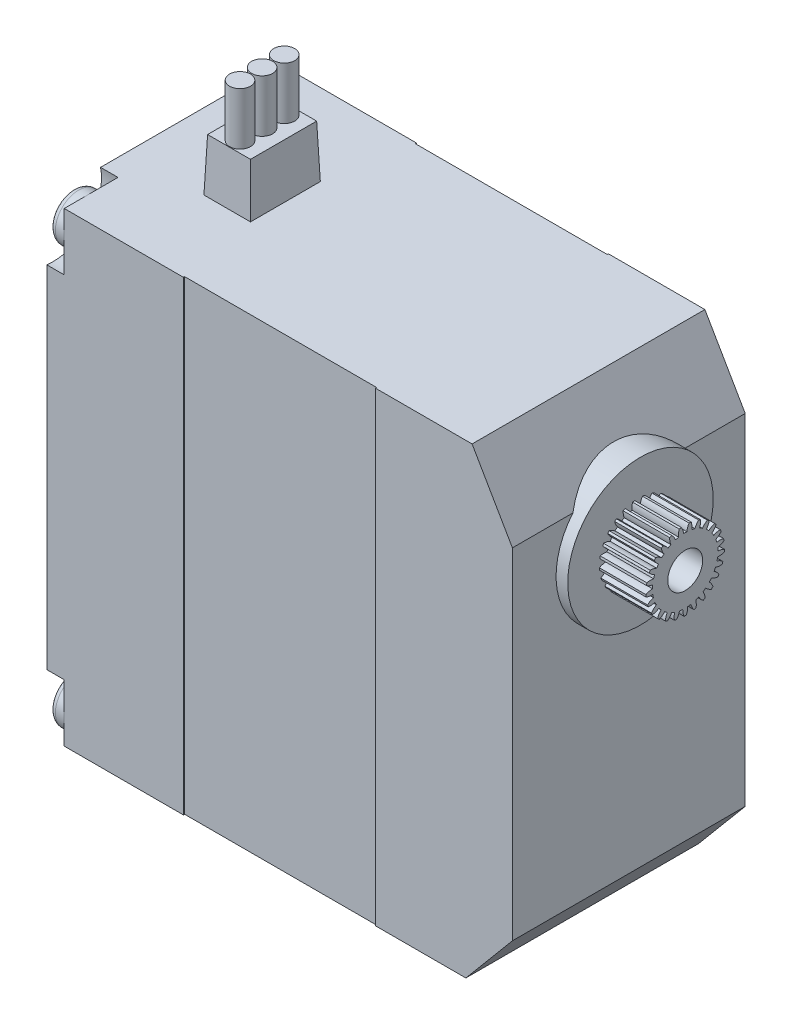
from build123d import *

# Parameters (mm, degrees)
SKETCH_1_W                     = 40
SKETCH_1_H                     = 40
EXTRUDE_1_DEPTH                = 20
SKETCH_2_R                     = 6.25
EXTRUDE_2_DEPTH                = 1
SKETCH_10_W                    = 16.5
SKETCH_10_H                    = 40
CUT_EXTRUDE_5_DEPTH            = 0.1
SKETCH_11_W                    = 16.5
SKETCH_11_H                    = 40
CUT_EXTRUDE_6_DEPTH            = 0.1
EXTRUDE_6_DEPTH                = 4
SKETCH_15_R                    = 1.5
CUT_EXTRUDE_9_DEPTH            = 4
CHAMFER_2_SIZE                 = 6
CHAMFER_2_SIZE_2               = 3.464101615
CHAMFER_3_SIZE                 = 4
CHAMFER_3_SIZE2                = 4.76701437
CUT_EXTRUDE_13_DEPTH           = 1.5
SKETCH_25_R                    = 2
EXTRUDE_10_DEPTH               = 1.3
FILLET_5_R                     = 0.5
CUT_EXTRUDE_14_DEPTH           = 0.8
CUT_EXTRUDE_14_DRAFT           = -16
CUT_EXTRUDE_14_PROFILE_2_DEPTH = 0.8
CUT_EXTRUDE_14_PROFILE_2_DRAFT = -16
CUT_EXTRUDE_14_PROFILE_3_DEPTH = 0.8
CUT_EXTRUDE_14_PROFILE_3_DRAFT = -16
CUT_EXTRUDE_14_PROFILE_4_DEPTH = 0.8
CUT_EXTRUDE_14_PROFILE_4_DRAFT = -16
EXTRUDE_11_DEPTH               = 4.5
EXTRUDE_11_TAPER               = 2
SKETCH_29_R                    = 0.9
EXTRUDE_12_DEPTH               = 4.5


with BuildPart() as part:
    # 草图1 → 凸台-拉伸1 (new body)
    with BuildSketch(Plane.XY):
        Rectangle(SKETCH_1_W, SKETCH_1_H)
    extrude(amount=EXTRUDE_1_DEPTH)

    # 草图2 → 凸台-拉伸2 (add)
    with BuildSketch(Plane(origin=(20, 0, 0), x_dir=(0, 0, -1), z_dir=(1, 0, 0))):
        with Locations(Location((-10, 10, 0), (0, 0, 180))):
            Circle(SKETCH_2_R)
    extrude(amount=EXTRUDE_2_DEPTH)

    # 草图10 → 切除-拉伸5 (cut)
    with BuildSketch(Plane(origin=(0, 0, 0), x_dir=(-1, 0, 0), z_dir=(0, 0, -1))):
        Rectangle(SKETCH_10_W, SKETCH_10_H)
    extrude(amount=-CUT_EXTRUDE_5_DEPTH, mode=Mode.SUBTRACT)

    # 草图11 → 切除-拉伸6 (cut)
    with BuildSketch(Plane.XY.offset(20)):
        Rectangle(SKETCH_11_W, SKETCH_11_H)
    extrude(amount=-CUT_EXTRUDE_6_DEPTH, mode=Mode.SUBTRACT)

    # 草图14 → 凸台-拉伸6 (add)
    with BuildSketch(Plane(origin=(21, 0, 0), x_dir=(0, 0, -1), z_dir=(1, 0, 0))):
        with BuildLine():
            ThreePointArc((-9.001803773, 13.072824063), (-9.190332602, 12.848308366), (-9.321381882, 12.586055618))
            ThreePointArc((-9.321381882, 12.586055618), (-9.456372375, 12.624330071), (-9.593104304, 12.655822077))
            ThreePointArc((-9.593104304, 12.655822077), (-9.581602438, 12.948769385), (-9.638650248, 13.236338446))
            ThreePointArc((-9.638650248, 13.236338446), (-9.732564329, 13.249545631), (-9.82681242, 13.260108856))
            ThreePointArc((-9.82681242, 13.260108856), (-9.953583485, 12.995761519), (-10.015296005, 12.709157293))
            ThreePointArc((-10.015296005, 12.709157293), (-10.155563992, 12.712658514), (-10.29583198, 12.709157293))
            ThreePointArc((-10.29583198, 12.709157293), (-10.357544499, 12.995761519), (-10.484315565, 13.260108856))
            ThreePointArc((-10.484315565, 13.260108856), (-10.578563656, 13.249545631), (-10.672477737, 13.236338446))
            ThreePointArc((-10.672477737, 13.236338446), (-10.729525547, 12.948769385), (-10.718023681, 12.655822077))
            ThreePointArc((-10.718023681, 12.655822077), (-10.85475561, 12.624330071), (-10.989746103, 12.586055618))
            ThreePointArc((-10.989746103, 12.586055618), (-11.120795382, 12.848308366), (-11.309324211, 13.072824063))
            ThreePointArc((-11.309324211, 13.072824063), (-11.397984358, 13.039154154), (-11.485663462, 13.003006415))
            ThreePointArc((-11.485663462, 13.003006415), (-11.469403493, 12.710284651), (-11.385409946, 12.42940122))
            ThreePointArc((-11.385409946, 12.42940122), (-11.510014447, 12.364894745), (-11.631245495, 12.294251983))
            ThreePointArc((-11.631245495, 12.294251983), (-11.823397227, 12.515674948), (-12.06183786, 12.686251859))
            ThreePointArc((-12.06183786, 12.686251859), (-12.139339219, 12.63159087), (-12.215274146, 12.574773872))
            ThreePointArc((-12.215274146, 12.574773872), (-12.126728071, 12.295292191), (-11.975520467, 12.044121574))
            ThreePointArc((-11.975520467, 12.044121574), (-12.080168181, 11.95065381), (-12.180022392, 11.852081485))
            ThreePointArc((-12.180022392, 11.852081485), (-12.421202977, 12.018761848), (-12.694573311, 12.124681997))
            ThreePointArc((-12.694573311, 12.124681997), (-12.756046187, 12.052464479), (-12.815465665, 11.978548244))
            ThreePointArc((-12.815465665, 11.978548244), (-12.66019716, 11.729867506), (-12.45127643, 11.524191679))
            ThreePointArc((-12.45127643, 11.524191679), (-12.529391955, 11.407635548), (-12.601595122, 11.287327321))
            ThreePointArc((-12.601595122, 11.287327321), (-12.876650296, 11.388791942), (-13.167773468, 11.423399977))
            ThreePointArc((-13.167773468, 11.423399977), (-13.209355294, 11.338163623), (-13.248525781, 11.251792578))
            ThreePointArc((-13.248525781, 11.251792578), (-13.036290937, 11.049538311), (-12.782784337, 10.90228064))
            ThreePointArc((-12.782784337, 10.90228064), (-12.829459388, 10.769959794), (-12.869474721, 10.635475073))
            ThreePointArc((-12.869474721, 10.635475073), (-13.161121755, 10.665348556), (-13.451705426, 10.626469928))
            ThreePointArc((-13.451705426, 10.626469928), (-13.470783464, 10.533570451), (-13.487243732, 10.440171607))
            ThreePointArc((-13.487243732, 10.440171607), (-13.231378045, 10.297052189), (-12.949214327, 10.217465417))
            ThreePointArc((-12.949214327, 10.217465417), (-12.961516139, 10.07769406), (-12.966829327, 9.937483015))
            ThreePointArc((-12.966829327, 9.937483015), (-13.256742967, 9.8938883), (-13.528528696, 9.783965895))
            ThreePointArc((-13.528528696, 9.783965895), (-13.523904201, 9.68924051), (-13.516619991, 9.594682461))
            ThreePointArc((-13.516619991, 9.594682461), (-13.233200443, 9.519690611), (-12.940108993, 9.512775467))
            ThreePointArc((-12.940108993, 9.512775467), (-12.917264598, 9.374335948), (-12.887541793, 9.237208556))
            ThreePointArc((-12.887541793, 9.237208556), (-13.157505698, 9.122884858), (-13.393416188, 8.948825505))
            ThreePointArc((-13.393416188, 8.948825505), (-13.365379735, 8.858226158), (-13.334808742, 8.768450333))
            ThreePointArc((-13.334808742, 8.768450333), (-13.041643625, 8.766298065), (-12.756040455, 8.832489053))
            ThreePointArc((-12.756040455, 8.832489053), (-12.69948525, 8.704080036), (-12.636594046, 8.578652513))
            ThreePointArc((-12.636594046, 8.578652513), (-12.869645391, 8.400783212), (-13.054857519, 8.1735237))
            ThreePointArc((-13.054857519, 8.1735237), (-13.005170741, 8.092743081), (-12.953233852, 8.013390425))
            ThreePointArc((-12.953233852, 8.013390425), (-12.66874381, 8.084212975), (-12.408574417, 8.219351071))
            ThreePointArc((-12.408574417, 8.219351071), (-12.321861974, 8.109040967), (-12.229754057, 8.003194387))
            ThreePointArc((-12.229754057, 8.003194387), (-12.411249369, 7.772955664), (-12.534125574, 7.506775545))
            ThreePointArc((-12.534125574, 7.506775545), (-12.465910475, 7.440889396), (-12.395871076, 7.376945929))
            ThreePointArc((-12.395871076, 7.376945929), (-12.137931663, 7.516293255), (-11.919543449, 7.711887236))
            ThreePointArc((-11.919543449, 7.711887236), (-11.808122229, 7.626607234), (-11.692585077, 7.546992327))
            ThreePointArc((-11.692585077, 7.546992327), (-11.811120338, 7.278850929), (-11.863939858, 6.990475278))
            ThreePointArc((-11.863939858, 6.990475278), (-11.781482642, 6.943623469), (-11.697741566, 6.899106994))
            ThreePointArc((-11.697741566, 6.899106994), (-11.482560065, 7.09822339), (-11.319675163, 7.341983367))
            ThreePointArc((-11.319675163, 7.341983367), (-11.190546172, 7.287091924), (-11.05883941, 7.238711187))
            ThreePointArc((-11.05883941, 7.238711187), (-11.106966614, 6.949515423), (-11.086410603, 6.657063943))
            ThreePointArc((-11.086410603, 6.657063943), (-10.994892362, 6.632190345), (-10.902711368, 6.609897996))
            ThreePointArc((-10.902711368, 6.609897996), (-10.743808424, 6.856272248), (-10.646661492, 7.132881885))
            ThreePointArc((-10.646661492, 7.132881885), (-10.507938378, 7.111828031), (-10.368337627, 7.097721404))
            ThreePointArc((-10.368337627, 7.097721404), (-10.343032763, 6.805642507), (-10.250392832, 6.527491))
            ThreePointArc((-10.250392832, 6.527491), (-10.155563992, 6.526158514), (-10.060735153, 6.527491))
            ThreePointArc((-10.060735153, 6.527491), (-9.968095221, 6.805642507), (-9.942790358, 7.097721404))
            ThreePointArc((-9.942790358, 7.097721404), (-9.803189606, 7.111828031), (-9.664466493, 7.132881885))
            ThreePointArc((-9.664466493, 7.132881885), (-9.567319561, 6.856272248), (-9.408416616, 6.609897996))
            ThreePointArc((-9.408416616, 6.609897996), (-9.316235623, 6.632190345), (-9.224717382, 6.657063943))
            ThreePointArc((-9.224717382, 6.657063943), (-9.204161371, 6.949515423), (-9.252288574, 7.238711187))
            ThreePointArc((-9.252288574, 7.238711187), (-9.120581812, 7.287091924), (-8.991452821, 7.341983367))
            ThreePointArc((-8.991452821, 7.341983367), (-8.828567919, 7.09822339), (-8.613386418, 6.899106994))
            ThreePointArc((-8.613386418, 6.899106994), (-8.529645342, 6.943623469), (-8.447188127, 6.990475278))
            ThreePointArc((-8.447188127, 6.990475278), (-8.500007647, 7.278850929), (-8.618542907, 7.546992327))
            ThreePointArc((-8.618542907, 7.546992327), (-8.503005756, 7.626607234), (-8.391584536, 7.711887236))
            ThreePointArc((-8.391584536, 7.711887236), (-8.173196321, 7.516293255), (-7.915256909, 7.376945929))
            ThreePointArc((-7.915256909, 7.376945929), (-7.84521751, 7.440889396), (-7.777002411, 7.506775545))
            ThreePointArc((-7.777002411, 7.506775545), (-7.899878616, 7.772955664), (-8.081373928, 8.003194387))
            ThreePointArc((-8.081373928, 8.003194387), (-7.98926601, 8.109040967), (-7.902553567, 8.219351071))
            ThreePointArc((-7.902553567, 8.219351071), (-7.642384175, 8.084212975), (-7.357894133, 8.013390425))
            ThreePointArc((-7.357894133, 8.013390425), (-7.305957244, 8.092743081), (-7.256270466, 8.1735237))
            ThreePointArc((-7.256270466, 8.1735237), (-7.441482594, 8.400783212), (-7.674533938, 8.578652513))
            ThreePointArc((-7.674533938, 8.578652513), (-7.611642734, 8.704080036), (-7.55508753, 8.832489053))
            ThreePointArc((-7.55508753, 8.832489053), (-7.269484359, 8.766298065), (-6.976319243, 8.768450333))
            ThreePointArc((-6.976319243, 8.768450333), (-6.94574825, 8.858226158), (-6.917711797, 8.948825505))
            ThreePointArc((-6.917711797, 8.948825505), (-7.153622287, 9.122884858), (-7.423586192, 9.237208556))
            ThreePointArc((-7.423586192, 9.237208556), (-7.393863387, 9.374335948), (-7.371018992, 9.512775467))
            ThreePointArc((-7.371018992, 9.512775467), (-7.077927541, 9.519690611), (-6.794507993, 9.594682461))
            ThreePointArc((-6.794507993, 9.594682461), (-6.787223784, 9.68924051), (-6.782599289, 9.783965895))
            ThreePointArc((-6.782599289, 9.783965895), (-7.054385018, 9.8938883), (-7.344298658, 9.937483015))
            ThreePointArc((-7.344298658, 9.937483015), (-7.349611845, 10.07769406), (-7.361913658, 10.217465417))
            ThreePointArc((-7.361913658, 10.217465417), (-7.07974994, 10.297052189), (-6.823884253, 10.440171607))
            ThreePointArc((-6.823884253, 10.440171607), (-6.840344521, 10.533570451), (-6.859422558, 10.626469928))
            ThreePointArc((-6.859422558, 10.626469928), (-7.15000623, 10.665348556), (-7.441653264, 10.635475073))
            ThreePointArc((-7.441653264, 10.635475073), (-7.481668597, 10.769959794), (-7.528343648, 10.90228064))
            ThreePointArc((-7.528343648, 10.90228064), (-7.274837048, 11.049538311), (-7.062602204, 11.251792578))
            ThreePointArc((-7.062602204, 11.251792578), (-7.10177269, 11.338163623), (-7.143354516, 11.423399977))
            ThreePointArc((-7.143354516, 11.423399977), (-7.434477689, 11.388791942), (-7.709532862, 11.287327321))
            ThreePointArc((-7.709532862, 11.287327321), (-7.78173603, 11.407635548), (-7.859851555, 11.524191679))
            ThreePointArc((-7.859851555, 11.524191679), (-7.650930824, 11.729867506), (-7.495662319, 11.978548244))
            ThreePointArc((-7.495662319, 11.978548244), (-7.555081798, 12.052464479), (-7.616554674, 12.124681997))
            ThreePointArc((-7.616554674, 12.124681997), (-7.889925008, 12.018761848), (-8.131105593, 11.852081485))
            ThreePointArc((-8.131105593, 11.852081485), (-8.230959804, 11.95065381), (-8.335607517, 12.044121574))
            ThreePointArc((-8.335607517, 12.044121574), (-8.184399914, 12.295292191), (-8.095853839, 12.574773872))
            ThreePointArc((-8.095853839, 12.574773872), (-8.171788766, 12.63159087), (-8.249290125, 12.686251859))
            ThreePointArc((-8.249290125, 12.686251859), (-8.487730757, 12.515674948), (-8.679882489, 12.294251983))
            ThreePointArc((-8.679882489, 12.294251983), (-8.801113538, 12.364894745), (-8.925718038, 12.42940122))
            ThreePointArc((-8.925718038, 12.42940122), (-8.841724492, 12.710284651), (-8.825464523, 13.003006415))
            ThreePointArc((-8.825464523, 13.003006415), (-8.913143627, 13.039154154), (-9.001803773, 13.072824063))
        make_face()
    extrude(amount=EXTRUDE_6_DEPTH)

    # 草图15 → 切除-拉伸9 (cut)
    with BuildSketch(Plane(origin=(25, 0, 0), x_dir=(0, 0, -1), z_dir=(1, 0, 0))):
        with Locations((-10.155563992, 9.901158514)):
            Circle(SKETCH_15_R)
    extrude(amount=-CUT_EXTRUDE_9_DEPTH, mode=Mode.SUBTRACT)

    # 倒角2
    # the kernel refuses this chamfer: 6, 3.464101615 mm, written as the material it takes off along each edge
    with BuildSketch(Plane(origin=(20, 20, -15.522514528), x_dir=(0.019326765612700865, -0.9998132206222078, 0), z_dir=(0, 0, 1))) as chamfer_2_piece_1_section:
        Polygon((CHAMFER_2_SIZE * 0.999813220622, -CHAMFER_2_SIZE * 0.0193267656127), (-CHAMFER_2_SIZE_2 * 0.0193267656135, -CHAMFER_2_SIZE_2 * 0.999813220662), (0, 0), align=None)
    chamfer_2_piece_1 = extrude(amount=51.045029056, mode=Mode.PRIVATE)
    chamfer_2_piece_1 = chamfer_2_piece_1 - Plane(origin=(18.872868859, 10, 10), x_dir=(0, 0, 1), z_dir=(-1, 0, 0)) * Cylinder(6.25, 127, mode=Mode.PRIVATE)
    add(chamfer_2_piece_1, mode=Mode.SUBTRACT)

    # 倒角3
    chamfer_3_edges = [part.edges().sort_by_distance(p)[0] for p in [
        (20, -20, 10),
    ]]
    chamfer_3_side = [part.faces().sort_by_distance(p)[0] for p in [
        (0, -20, 10),
    ]]
    chamfer(chamfer_3_edges, length=CHAMFER_3_SIZE, length2=CHAMFER_3_SIZE2, reference=chamfer_3_side[0])

    # 草图24 → 切除-拉伸13 (cut)
    with BuildSketch(Plane.ZY.offset(20)):
        with BuildLine():
            Line((0, 15.059831138), (0, 20))
            Line((0, 20), (4.619724316, 20))
            ThreePointArc((4.619724316, 20), (3.582907294, 16.339446633), (0, 15.059831138))
        make_face()
        with BuildLine():
            Line((20, 15.059831138), (20, 20))
            Line((20, 20), (15.380275684, 20))
            ThreePointArc((15.380275684, 20), (16.417092706, 16.339446633), (20, 15.059831138))
        make_face()
        with BuildLine():
            Line((0, -20), (4.619724316, -20))
            ThreePointArc((4.619724316, -20), (3.582907294, -16.339446633), (0, -15.059831138))
            Line((0, -15.059831138), (0, -20))
        make_face()
        with BuildLine():
            Line((20, -20), (15.380275684, -20))
            ThreePointArc((15.380275684, -20), (16.417092706, -16.339446633), (20, -15.059831138))
            Line((20, -15.059831138), (20, -20))
        make_face()
    extrude(amount=-CUT_EXTRUDE_13_DEPTH, mode=Mode.SUBTRACT)

    # 草图25 → 凸台-拉伸10 (add)
    with BuildSketch(Plane.ZY.offset(18.5)):
        with Locations(Location((2.039859112, 17.947190939, 0), (0, 0, 180))):
            Circle(SKETCH_25_R)
        with Locations(Location((17.960140888, 17.947190939, 0), (0, 0, 180))):
            Circle(SKETCH_25_R)
        with Locations(Location((2.039859112, -17.947190939, 0), (0, 0, 180))):
            Circle(SKETCH_25_R)
        with Locations(Location((17.960140888, -17.947190939, 0), (0, 0, 180))):
            Circle(SKETCH_25_R)
    extrude(amount=EXTRUDE_10_DEPTH)

    # 圆角5
    fillet_5_edges = [part.edges().sort_by_distance(p)[0] for p in [
        (-19.8, 17.947190939, 4.039859112),
        (-19.8, 17.947190939, 19.960140888),
        (-19.8, -17.947190939, 4.039859112),
        (-19.8, -17.947190939, 19.960140888),
    ]]
    fillet(fillet_5_edges, radius=FILLET_5_R)


with BuildPart() as cut_extrude_14_tool:
    # 草图26 → 切除-拉伸14 (with draft: the straight prism first)
    with BuildSketch(Plane.ZY.offset(19.8)):
        Polygon((1.639859112, 18.347190939), (0.594175883, 18.347190939), (0.594175883, 17.547190939), (1.639859112, 17.547190939), (1.639859112, 16.501507709), (2.439859112, 16.501507709), (2.439859112, 17.547190939), (3.485542342, 17.547190939), (3.485542342, 18.347190939), (2.439859112, 18.347190939), (2.439859112, 19.392874168), (1.639859112, 19.392874168), align=None)
    extrude(amount=-CUT_EXTRUDE_14_DEPTH)
    # 切除-拉伸14: the draft: its side faces are tilted about the plane it starts from
    cut_extrude_14_sides = [cut_extrude_14_tool.faces().sort_by_distance(p)[0] for p in [
        (-19.4, 18.347190939, 1.117017497),
        (-19.4, 17.947190939, 0.594175883),
        (-19.4, 17.547190939, 1.117017497),
        (-19.4, 17.024349324, 1.639859112),
        (-19.4, 16.501507709, 2.039859112),
        (-19.4, 17.024349324, 2.439859112),
        (-19.4, 17.547190939, 2.962700727),
        (-19.4, 17.947190939, 3.485542342),
        (-19.4, 18.347190939, 2.962700727),
        (-19.4, 18.870032553, 2.439859112),
        (-19.4, 19.392874168, 2.039859112),
        (-19.4, 18.870032553, 1.639859112),
    ]]
    draft(cut_extrude_14_sides, Plane.ZY.offset(19.8), CUT_EXTRUDE_14_DRAFT)


with BuildPart() as part_1:
    add(part.part)

    # 切除-拉伸14: cut by cut_extrude_14_tool
    add(cut_extrude_14_tool.part, mode=Mode.SUBTRACT)


with BuildPart() as cut_extrude_14_profile_2_tool:
    # 草图26 → 切除-拉伸14 profile 2 (with draft: the straight prism first)
    with BuildSketch(Plane.ZY.offset(19.8)):
        Polygon((18.387715981, 18.347190939), (18.387715981, 19.392874168), (17.587715981, 19.392874168), (17.587715981, 18.347190939), (16.542032752, 18.347190939), (16.542032752, 17.547190939), (17.587715981, 17.547190939), (17.587715981, 16.501507709), (18.387715981, 16.501507709), (18.387715981, 17.547190939), (19.433399211, 17.547190939), (19.433399211, 18.347190939), align=None)
    extrude(amount=-CUT_EXTRUDE_14_PROFILE_2_DEPTH)
    # 切除-拉伸14 profile 2: the draft: its side faces are tilted about the plane it starts from
    cut_extrude_14_profile_2_sides = [cut_extrude_14_profile_2_tool.faces().sort_by_distance(p)[0] for p in [
        (-19.4, 18.870032553, 18.387715981),
        (-19.4, 19.392874168, 17.987715981),
        (-19.4, 18.870032553, 17.587715981),
        (-19.4, 18.347190939, 17.064874366),
        (-19.4, 17.947190939, 16.542032752),
        (-19.4, 17.547190939, 17.064874366),
        (-19.4, 17.024349324, 17.587715981),
        (-19.4, 16.501507709, 17.987715981),
        (-19.4, 17.024349324, 18.387715981),
        (-19.4, 17.547190939, 18.910557596),
        (-19.4, 17.947190939, 19.433399211),
        (-19.4, 18.347190939, 18.910557596),
    ]]
    draft(cut_extrude_14_profile_2_sides, Plane.ZY.offset(19.8), CUT_EXTRUDE_14_PROFILE_2_DRAFT)


with BuildPart() as part_2:
    add(part_1.part)

    # 切除-拉伸14 profile 2: cut by cut_extrude_14_profile_2_tool
    add(cut_extrude_14_profile_2_tool.part, mode=Mode.SUBTRACT)


with BuildPart() as cut_extrude_14_profile_3_tool:
    # 草图26 → 切除-拉伸14 profile 3 (with draft: the straight prism first)
    with BuildSketch(Plane.ZY.offset(19.8)):
        Polygon((18.387715981, -18.347190939), (19.433399211, -18.347190939), (19.433399211, -17.547190939), (18.387715981, -17.547190939), (18.387715981, -16.501507709), (17.587715981, -16.501507709), (17.587715981, -17.547190939), (16.542032752, -17.547190939), (16.542032752, -18.347190939), (17.587715981, -18.347190939), (17.587715981, -19.392874168), (18.387715981, -19.392874168), align=None)
    extrude(amount=-CUT_EXTRUDE_14_PROFILE_3_DEPTH)
    # 切除-拉伸14 profile 3: the draft: its side faces are tilted about the plane it starts from
    cut_extrude_14_profile_3_sides = [cut_extrude_14_profile_3_tool.faces().sort_by_distance(p)[0] for p in [
        (-19.4, -18.347190939, 18.910557596),
        (-19.4, -17.947190939, 19.433399211),
        (-19.4, -17.547190939, 18.910557596),
        (-19.4, -17.024349324, 18.387715981),
        (-19.4, -16.501507709, 17.987715981),
        (-19.4, -17.024349324, 17.587715981),
        (-19.4, -17.547190939, 17.064874366),
        (-19.4, -17.947190939, 16.542032752),
        (-19.4, -18.347190939, 17.064874366),
        (-19.4, -18.870032553, 17.587715981),
        (-19.4, -19.392874168, 17.987715981),
        (-19.4, -18.870032553, 18.387715981),
    ]]
    draft(cut_extrude_14_profile_3_sides, Plane.ZY.offset(19.8), CUT_EXTRUDE_14_PROFILE_3_DRAFT)


with BuildPart() as part_3:
    add(part_2.part)

    # 切除-拉伸14 profile 3: cut by cut_extrude_14_profile_3_tool
    add(cut_extrude_14_profile_3_tool.part, mode=Mode.SUBTRACT)


with BuildPart() as cut_extrude_14_profile_4_tool:
    # 草图26 → 切除-拉伸14 profile 4 (with draft: the straight prism first)
    with BuildSketch(Plane.ZY.offset(19.8)):
        Polygon((1.639859112, -18.347190939), (1.639859112, -19.392874168), (2.439859112, -19.392874168), (2.439859112, -18.347190939), (3.485542342, -18.347190939), (3.485542342, -17.547190939), (2.439859112, -17.547190939), (2.439859112, -16.501507709), (1.639859112, -16.501507709), (1.639859112, -17.547190939), (0.594175883, -17.547190939), (0.594175883, -18.347190939), align=None)
    extrude(amount=-CUT_EXTRUDE_14_PROFILE_4_DEPTH)
    # 切除-拉伸14 profile 4: the draft: its side faces are tilted about the plane it starts from
    cut_extrude_14_profile_4_sides = [cut_extrude_14_profile_4_tool.faces().sort_by_distance(p)[0] for p in [
        (-19.4, -18.870032553, 1.639859112),
        (-19.4, -19.392874168, 2.039859112),
        (-19.4, -18.870032553, 2.439859112),
        (-19.4, -18.347190939, 2.962700727),
        (-19.4, -17.947190939, 3.485542342),
        (-19.4, -17.547190939, 2.962700727),
        (-19.4, -17.024349324, 2.439859112),
        (-19.4, -16.501507709, 2.039859112),
        (-19.4, -17.024349324, 1.639859112),
        (-19.4, -17.547190939, 1.117017497),
        (-19.4, -17.947190939, 0.594175883),
        (-19.4, -18.347190939, 1.117017497),
    ]]
    draft(cut_extrude_14_profile_4_sides, Plane.ZY.offset(19.8), CUT_EXTRUDE_14_PROFILE_4_DRAFT)


with BuildPart() as part_4:
    add(part_3.part)

    # 切除-拉伸14 profile 4: cut by cut_extrude_14_profile_4_tool
    add(cut_extrude_14_profile_4_tool.part, mode=Mode.SUBTRACT)

    # 草图28 → 凸台-拉伸11 (add)
    with BuildSketch(Plane(origin=(0, 20, 0), x_dir=(1, 0, 0), z_dir=(0, 1, 0))):
        Polygon((-9.5, -10), (-9.5, -7), (-13.5, -7), (-13.5, -13), (-9.5, -13), align=None)
    extrude(amount=EXTRUDE_11_DEPTH, taper=EXTRUDE_11_TAPER)

    # 草图29 → 凸台-拉伸12 (add)
    with BuildSketch(Plane(origin=(0, 24.5, 0), x_dir=(1, 0, 0), z_dir=(0, 1, 0))):
        with Locations(Location((-11.5, -11.9, 0), (0, 0, 270))):
            Circle(SKETCH_29_R)
        with Locations(Location((-11.5, -8.1, 0), (0, 0, 270))):
            Circle(SKETCH_29_R)
        with Locations(Location((-11.5, -10.002513208, 0), (0, 0, 270))):
            Circle(SKETCH_29_R)
    extrude(amount=EXTRUDE_12_DEPTH)


solid = part_4.part
